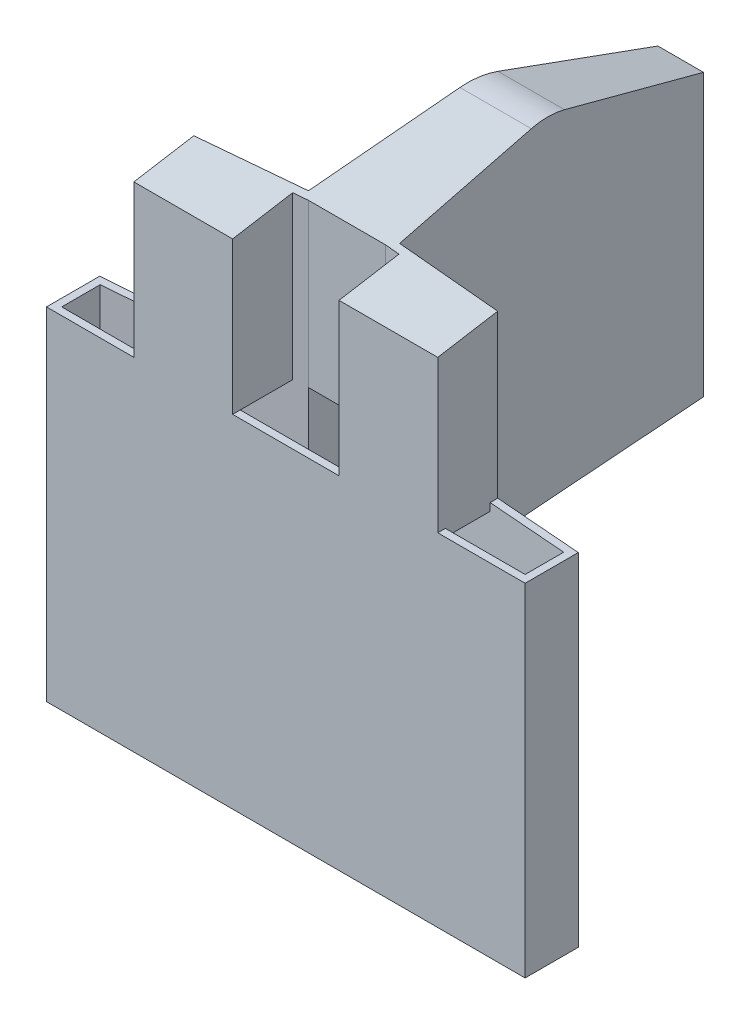
from build123d import *

# Parameters (mm, degrees)
BOSS_EXTRUDE1_DEPTH     = 70
CUT_EXTRUDE1_DEPTH      = 25
CUT_EXTRUDE4_DEPTH      = 24
CUT_EXTRUDE4_DEPTH_BACK = 27
SHELL2_T                = -1
FILLET1_R               = 10
CUT_EXTRUDE3_DEPTH      = 26
CUT_EXTRUDE2_DEPTH      = 1
BOSS_EXTRUDE4_DEPTH     = 21.5
BOSS_EXTRUDE5_DEPTH     = 22
CUT_EXTRUDE8_DEPTH      = 20
CUT_EXTRUDE10_DEPTH     = 34


with BuildPart() as part:
    # Sketch2 → Boss-Extrude1 (new body)
    with BuildSketch(Plane(origin=(0, 0, 0), x_dir=(1, 0, 0), z_dir=(0, 1, 0))):
        Polygon((-18.988562983, 28.382917999), (-4.988562983, 29.470238095), (-1.988562983, 72.470238095), (4.011437017, 72.470238095), (7.011437017, 29.470238095), (32.511437017, 27.489762205), (32.511437017, 20.489762205), (-30.488562983, 20.489762205), (-30.488562983, 27.489762205), align=None)
    extrude(amount=BOSS_EXTRUDE1_DEPTH)

    # Sketch3 → Cut-Extrude1 (cut)
    with BuildSketch(Plane(origin=(0, 70, 0), x_dir=(1, 0, 0), z_dir=(0, 1, 0))):
        Polygon((-30.488562983, 27.489762205), (-30.488562983, 20.489762205), (-18.988562983, 20.489762205), (-18.988562983, 28.382917999), align=None)
        Polygon((21.011437017, 20.489762205), (32.511437017, 20.489762205), (32.511437017, 27.489762205), (21.011437017, 28.382917999), align=None)
    extrude(amount=-CUT_EXTRUDE1_DEPTH, mode=Mode.SUBTRACT)

    # Sketch7 → Cut-Extrude4 (cut, two sides: drawn at the far end of the back side and taken through both)
    with BuildSketch(Plane(origin=(0, 0, 0), x_dir=(0, 0, -1), z_dir=(1, 0, 0)).offset(-CUT_EXTRUDE4_DEPTH_BACK)):
        Polygon((50.489762205, 70), (20.489762205, 70), (20.489762205, 65), align=None)
        Polygon((72.470238095, 70), (50.489762205, 70), (72.470238095, 63), align=None)
    extrude(amount=CUT_EXTRUDE4_DEPTH + CUT_EXTRUDE4_DEPTH_BACK, mode=Mode.SUBTRACT)

    # Shell2
    shell2_openings = [part.faces().sort_by_distance(p)[0] for p in [
        (1.011437017, 0, -34.888692943),
    ]]
    offset(amount=SHELL2_T, openings=shell2_openings, kind=Kind.INTERSECTION)

    # Fillet1
    fillet1_edges = [part.edges().sort_by_distance(p)[0] for p in [
        (1.011437017, 70, -50.489762205),
    ]]
    fillet(fillet1_edges, radius=FILLET1_R)

    # Sketch6 → Cut-Extrude3 (cut)
    with BuildSketch(Plane.XZ):
        Polygon((-4.988562983, -29.470238095), (7.011437017, -29.470238095), (4.011437017, -72.470238095), (-1.988562983, -72.470238095), align=None)
    extrude(amount=-CUT_EXTRUDE3_DEPTH, mode=Mode.SUBTRACT)

    # Sketch4 → Cut-Extrude2 (cut)
    with BuildSketch(Plane(origin=(0, 45, 0), x_dir=(1, 0, 0), z_dir=(0, 1, 0))):
        Polygon((31.511437017, 21.489762205), (21.011437017, 21.489762205), (21.011437017, 27.379906551), (31.511437017, 26.564416479), align=None)
        Polygon((-29.488562983, 21.489762205), (-29.488562983, 26.564416479), (-18.988562983, 27.379906551), (-18.988562983, 21.489762205), align=None)
    extrude(amount=-CUT_EXTRUDE2_DEPTH, mode=Mode.SUBTRACT)

    # Sketch16 → Boss-Extrude4 (add)
    with BuildSketch(Plane(origin=(0, 45, 0), x_dir=(-1, 0, 0), z_dir=(0, -1, 0))):
        Polygon((-6.009006224, 29.470238095), (3.986132189, 29.470238095), (4.051029671, 28.540040848), (-6.073903706, 28.540040848), align=None)
    extrude(amount=-BOSS_EXTRUDE4_DEPTH)

    # Sketch19 → Boss-Extrude5 (add)
    with BuildSketch(Plane(origin=(0, 45, 0), x_dir=(-1, 0, 0), z_dir=(0, -1, 0))):
        Polygon((5.988562983, 28.389560926), (5.988562983, 21.489762205), (6.988562983, 21.489762205), (6.988562983, 28.311895205), align=None)
        Polygon((-8.011437017, 21.489762205), (-8.011437017, 28.389560926), (-9.011437017, 28.311895205), (-9.011437017, 21.489762205), align=None)
    extrude(amount=-BOSS_EXTRUDE5_DEPTH)

    # Sketch20 → Cut-Extrude8 (cut, symmetric)
    with BuildSketch(Plane(origin=(-5.988562983, 0, 0), x_dir=(0, 0, -1), z_dir=(1, 0, 0))):
        Polygon((21.489762205, 67), (21.489762205, 65.166666667), (30.609777223, 66.68666917), (30.609777223, 67), align=None)
    extrude(amount=CUT_EXTRUDE8_DEPTH, both=True, mode=Mode.SUBTRACT)

    # Sketch22 → Cut-Extrude10 (cut)
    with BuildSketch(Plane(origin=(0, 45, 0), x_dir=(-1, 0, 0), z_dir=(0, -1, 0))):
        Polygon((-8.011437017, 28.389560926), (-8.011437017, 20.489762205), (5.988562983, 20.489762205), (5.988562983, 28.389560926), (4.051029671, 28.540040848), (-6.073903706, 28.540040848), align=None)
    extrude(amount=-CUT_EXTRUDE10_DEPTH, mode=Mode.SUBTRACT)


solid = part.part
